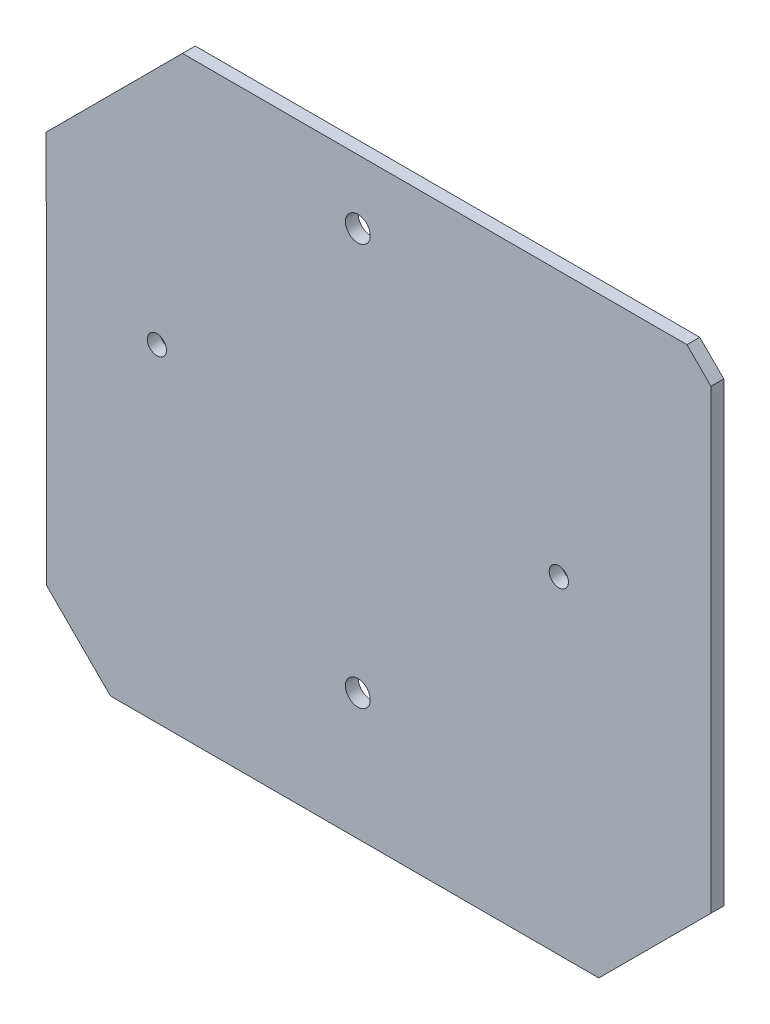
from build123d import *

# Parameters (mm, degrees)
BOSS_EXTRUDE1_DEPTH = 1.6
CUT_EXTRUDE3_REACH  = 62.168
SKETCH3_R           = 1.55
SKETCH3_R_2         = 1.2


with BuildPart() as part:
    # Outline → Boss-Extrude1 (new body)
    with BuildSketch(Plane.XY):
        Polygon((-21.900006167, 33.099991446), (41.100000471, 33.099991446), (44.099993323, 30.099991079), (44.099993323, -26.900015408), (30.099993251, -40.900008554), (-30.900013587, -40.900008554), (-38.900041463, -32.899973639), (-38.914868879, 16.08518791), align=None)
    extrude(amount=BOSS_EXTRUDE1_DEPTH)

    # Sketch3 → Cut-Extrude3 (cut, up to next)
    with BuildSketch(Plane.XY.offset(1.6), mode=Mode.PRIVATE) as cut_extrude3_sk1:
        with Locations((-6.677e-06, 25.099991446)):
            Circle(SKETCH3_R)
    cut_extrude3_tool1 = extrude(cut_extrude3_sk1.sketch, amount=-CUT_EXTRUDE3_REACH, mode=Mode.PRIVATE) & part.part
    # Sketch3 → Cut-Extrude3 (cut, up to next)
    with BuildSketch(Plane.XY.offset(1.6), mode=Mode.PRIVATE) as cut_extrude3_sk2:
        with Locations((25.099993323, -8.554e-06)):
            Circle(SKETCH3_R_2)
    cut_extrude3_tool2 = extrude(cut_extrude3_sk2.sketch, amount=-CUT_EXTRUDE3_REACH, mode=Mode.PRIVATE) & part.part
    # Sketch3 → Cut-Extrude3 (cut, up to next)
    with BuildSketch(Plane.XY.offset(1.6), mode=Mode.PRIVATE) as cut_extrude3_sk3:
        with Locations((-6.677e-06, -25.100008554)):
            Circle(SKETCH3_R)
    cut_extrude3_tool3 = extrude(cut_extrude3_sk3.sketch, amount=-CUT_EXTRUDE3_REACH, mode=Mode.PRIVATE) & part.part
    # Sketch3 → Cut-Extrude3 (cut, up to next)
    with BuildSketch(Plane.XY.offset(1.6), mode=Mode.PRIVATE) as cut_extrude3_sk4:
        with Locations((-25.100006677, -8.554e-06)):
            Circle(SKETCH3_R_2)
    cut_extrude3_tool4 = extrude(cut_extrude3_sk4.sketch, amount=-CUT_EXTRUDE3_REACH, mode=Mode.PRIVATE) & part.part
    add(cut_extrude3_tool1.solids().sort_by_distance((-7e-06, 25.099991, 1.6))[0], mode=Mode.SUBTRACT)
    add(cut_extrude3_tool2.solids().sort_by_distance((25.099993, -9e-06, 1.6))[0], mode=Mode.SUBTRACT)
    add(cut_extrude3_tool3.solids().sort_by_distance((-7e-06, -25.100009, 1.6))[0], mode=Mode.SUBTRACT)
    add(cut_extrude3_tool4.solids().sort_by_distance((-25.100007, -9e-06, 1.6))[0], mode=Mode.SUBTRACT)


solid = part.part
